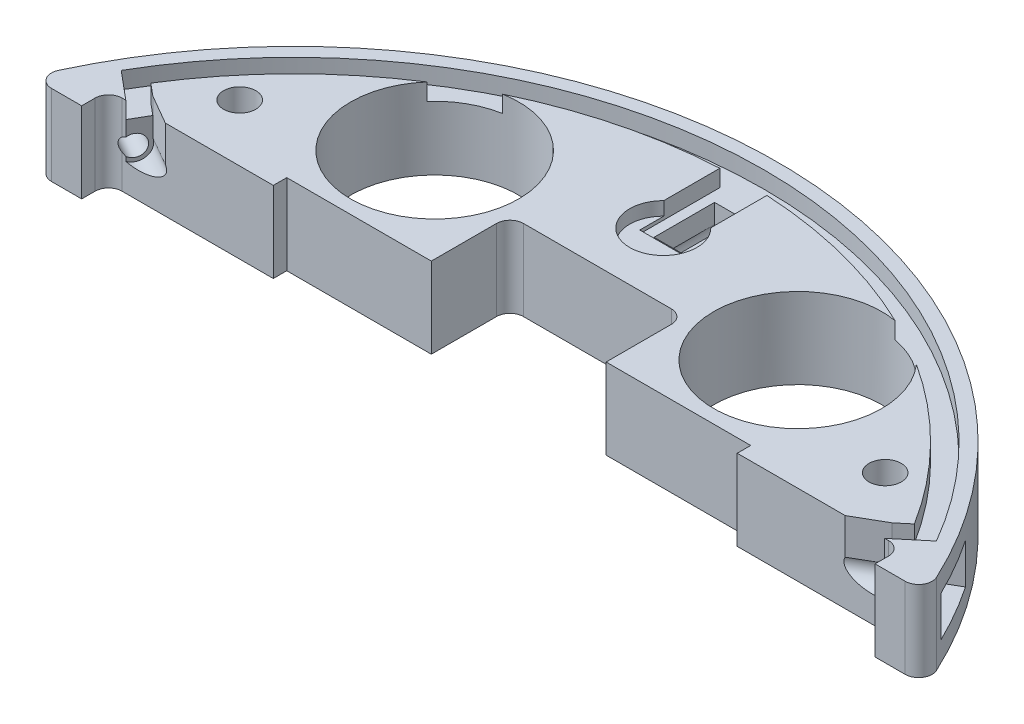
from build123d import *

# Parameters (mm, degrees)
BOSS_EXTRUDE1_DEPTH  = 6
SOLENOID_PLACEMENT_W = 38
SOLENOID_PLACEMENT_H = 64
CUT_EXTRUDE1_DEPTH   = 103.528044944
CUT_EXTRUDE4_DEPTH   = 103.528044944
SKETCH5_R            = 12.5
CUT_EXTRUDE5_DEPTH   = 103.528044944
SKETCH6_R            = 2.4
CUT_EXTRUDE6_DEPTH   = 103.528044944
CUT_EXTRUDE3_DEPTH   = 103.528044944
FILLET1_R            = 2
CUT_EXTRUDE7_DEPTH   = 3
SKETCH10_R           = 5
CUT_EXTRUDE9_DEPTH   = 2
SKETCH11_W           = 69
SKETCH11_H           = 67
CUT_EXTRUDE10_DEPTH  = 99.059529102
SKETCH13_R           = 1.55
CUT_EXTRUDE11_DEPTH  = 4.2
SKETCH14_R           = 2.1
CUT_EXTRUDE12_DEPTH  = 9
SKETCH15_W           = 4
SKETCH15_H           = 10.882727098
CUT_EXTRUDE13_DEPTH  = 9
CIRPATTERN1_COUNT    = 3
CIRPATTERN1_ANGLE    = 120
CUT_EXTRUDE14_DEPTH  = 2.5


with BuildPart() as part:
    # Sketch1 → Boss-Extrude1 (new, symmetric)
    with BuildSketch(Plane(origin=(0, 0, 0), x_dir=(1, 0, 0), z_dir=(0, 1, 0))):
        with BuildLine():
            ThreePointArc((36.224522061, -62.223661106), (0, 72), (-36.224522061, -62.223661106))
            ThreePointArc((-36.224522061, -62.223661106), (-32.797800029, -62.818856853), (-29.811944095, -61.035223988))
            ThreePointArc((-29.811944095, -61.035223988), (0, -46.75), (29.811944095, -61.035223988))
            ThreePointArc((29.811944095, -61.035223988), (32.797800029, -62.818856853), (36.224522061, -62.223661106))
        make_face()
    extrude(amount=BOSS_EXTRUDE1_DEPTH, both=True)

    # solenoid placement → Cut-Extrude1 (cut, through all)
    with BuildSketch(Plane(origin=(0, 6, 0), x_dir=(1, 0, 0), z_dir=(0, 1, 0))):
        with Locations((0, -4)):
            Rectangle(SOLENOID_PLACEMENT_W, SOLENOID_PLACEMENT_H)
    extrude(amount=-CUT_EXTRUDE1_DEPTH, mode=Mode.SUBTRACT)

    # Sketch4 → Cut-Extrude4 (cut, through all)
    with BuildSketch(Plane(origin=(0, 6, 0), x_dir=(1, 0, 0), z_dir=(0, 1, 0))):
        with BuildLine():
            Line((-13, 28), (13, 28))
            Line((13, 28), (13, 43.2))
            ThreePointArc((13, 43.2), (12.414213562, 44.614213562), (11, 45.2))
            Line((11, 45.2), (-11, 45.2))
            ThreePointArc((-11, 45.2), (-12.414213562, 44.614213562), (-13, 43.2))
            Line((-13, 43.2), (-13, 28))
        make_face()
    extrude(amount=-CUT_EXTRUDE4_DEPTH, mode=Mode.SUBTRACT)

    # Sketch5 → Cut-Extrude5 (cut, through all)
    with BuildSketch(Plane(origin=(0, 6, 0), x_dir=(1, 0, 0), z_dir=(0, 1, 0))):
        with Locations((27, 48)):
            Circle(SKETCH5_R)
        with Locations((-27, 48)):
            Circle(SKETCH5_R)
    extrude(amount=-CUT_EXTRUDE5_DEPTH, mode=Mode.SUBTRACT)

    # Sketch6 → Cut-Extrude6 (cut, through all)
    with BuildSketch(Plane(origin=(0, 6, 0), x_dir=(1, 0, 0), z_dir=(0, 1, 0))):
        with Locations((48, 40)):
            Circle(SKETCH6_R)
        with Locations((-48, 40)):
            Circle(SKETCH6_R)
    extrude(amount=-CUT_EXTRUDE6_DEPTH, mode=Mode.SUBTRACT)

    # Sketch3 → Cut-Extrude3 (cut, through all)
    with BuildSketch(Plane(origin=(0, 6, 0), x_dir=(1, 0, 0), z_dir=(0, 1, 0))):
        Polygon((-72, -31.5), (-72, 27.5), (-59, 27.5), (-59, 31.5), (0, 31.5), (59, 31.5), (59, 27.5), (72, 27.5), (72, -31.5), (72, -101.646422462), (-72, -101.646422462), align=None)
    extrude(amount=-CUT_EXTRUDE3_DEPTH, mode=Mode.SUBTRACT)

    # Fillet1
    fillet1_edges = [part.edges().sort_by_distance(p)[0] for p in [
        (-66.541340534, 0, -27.5),
        (-59, 0, -31.5),
        (59, 0, -31.5),
        (66.541340534, 0, -27.5),
    ]]
    fillet(fillet1_edges, radius=FILLET1_R)

    # Sketch8 → Cut-Extrude7 (cut, symmetric)
    with BuildSketch(Plane(origin=(0, 0, 0), x_dir=(1, 0, 0), z_dir=(0, 1, 0))):
        with BuildLine():
            Line((5, 71.826179071), (5, 68.826179071))
            Line((5, 68.826179071), (-5, 68.826179071))
            Line((-5, 68.826179071), (-5, 71.826179071))
            ThreePointArc((-5, 71.826179071), (0, 72), (5, 71.826179071))
        make_face()
        with BuildLine():
            Line((64.703295733, 31.582962517), (62.105219521, 30.082962517))
            Line((62.105219521, 30.082962517), (57.105219521, 38.743216555))
            Line((57.105219521, 38.743216555), (59.703295733, 40.243216555))
            ThreePointArc((59.703295733, 40.243216555), (62.353829072, 36), (64.703295733, 31.582962517))
        make_face()
        with BuildLine():
            Line((-59.703295733, 40.243216555), (-57.105219521, 38.743216555))
            Line((-57.105219521, 38.743216555), (-62.105219521, 30.082962517))
            Line((-62.105219521, 30.082962517), (-64.703295733, 31.582962517))
            ThreePointArc((-64.703295733, 31.582962517), (-62.353829072, 36), (-59.703295733, 40.243216555))
        make_face()
    extrude(amount=CUT_EXTRUDE7_DEPTH, both=True, mode=Mode.SUBTRACT)

    # Sketch10 → Cut-Extrude9 (cut)
    with BuildSketch(Plane(origin=(0, 6, 0), x_dir=(1, 0, 0), z_dir=(0, 1, 0))):
        with Locations((0, 55)):
            Circle(SKETCH10_R)
    extrude(amount=-CUT_EXTRUDE9_DEPTH, mode=Mode.SUBTRACT)

    # Sketch11 → Cut-Extrude10 (cut, through all)
    with BuildSketch(Plane(origin=(0, 6, 0), x_dir=(1, 0, 0), z_dir=(0, 1, 0))):
        Rectangle(SKETCH11_W, SKETCH11_H)
    extrude(amount=-CUT_EXTRUDE10_DEPTH, mode=Mode.SUBTRACT)

    # Sketch13 → Cut-Extrude11 (cut)
    with BuildSketch(Plane(origin=(-59.605219521, 0, -34.413089536), x_dir=(-0.5000000000000001, 0, 0.8660254037844386), z_dir=(-0.8660254037844386, 0, -0.5000000000000001))):
        Circle(SKETCH13_R)
    cut_extrude11 = extrude(amount=-CUT_EXTRUDE11_DEPTH, mode=Mode.SUBTRACT)

    # Sketch14 → Cut-Extrude12 (cut)
    with BuildSketch(Plane(origin=(-55.967912825, 0, -32.313089536), x_dir=(-0.5000000000000001, 0, 0.8660254037844386), z_dir=(-0.8660254037844386, 0, -0.5000000000000001))):
        Circle(SKETCH14_R)
    cut_extrude12 = extrude(amount=-CUT_EXTRUDE12_DEPTH, mode=Mode.SUBTRACT)

    # Sketch15 → Cut-Extrude13 (cut)
    with BuildSketch(Plane(origin=(-55.967912825, 0, -32.313089536), x_dir=(0.5000000000000001, 0, -0.8660254037844386), z_dir=(0.8660254037844386, 0, 0.5000000000000001))):
        with Locations((0, 5.441363549)):
            Rectangle(SKETCH15_W, SKETCH15_H)
    cut_extrude13 = extrude(amount=CUT_EXTRUDE13_DEPTH, mode=Mode.SUBTRACT)

    # CirPattern1: Cut-Extrude11, Cut-Extrude12, Cut-Extrude13 ×3 about axis
    cirpattern1_axis = Axis((0, 6, 0), (0, -1, 0))
    add([cut_extrude11.rotate(cirpattern1_axis, i * CIRPATTERN1_ANGLE / (CIRPATTERN1_COUNT - 1)) for i in range(1, CIRPATTERN1_COUNT)], mode=Mode.SUBTRACT)
    add([cut_extrude12.rotate(cirpattern1_axis, i * CIRPATTERN1_ANGLE / (CIRPATTERN1_COUNT - 1)) for i in range(1, CIRPATTERN1_COUNT)], mode=Mode.SUBTRACT)
    add([cut_extrude13.rotate(cirpattern1_axis, i * CIRPATTERN1_ANGLE / (CIRPATTERN1_COUNT - 1)) for i in range(1, CIRPATTERN1_COUNT)], mode=Mode.SUBTRACT)

    # Sketch16 → Cut-Extrude14 (cut)
    with BuildSketch(Plane(origin=(0, 6, 0), x_dir=(1, 0, 0), z_dir=(0, 1, 0))):
        with BuildLine():
            Line((-56.437350288, 31.5), (-60.621778265, 35))
            ThreePointArc((-60.621778265, 35), (0, 70), (60.621778265, 35))
            Line((60.621778265, 35), (56.437350288, 31.5))
            Line((56.437350288, 31.5), (54.967912825, 34.045140343))
            Line((54.967912825, 34.045140343), (56.782651118, 35.563050094))
            ThreePointArc((56.782651118, 35.563050094), (33.972549532, 57.748297623), (3.5, 66.908519637))
            Line((3.5, 66.908519637), (3.5, 55))
            Line((3.5, 55), (-3.5, 55))
            Line((-3.5, 55), (-3.5, 66.908519637))
            ThreePointArc((-3.5, 66.908519637), (-33.972549532, 57.748297623), (-56.782651118, 35.563050094))
            Line((-56.782651118, 35.563050094), (-54.967912825, 34.045140343))
            Line((-54.967912825, 34.045140343), (-56.437350288, 31.5))
        make_face()
    extrude(amount=-CUT_EXTRUDE14_DEPTH, mode=Mode.SUBTRACT)


solid = part.part
